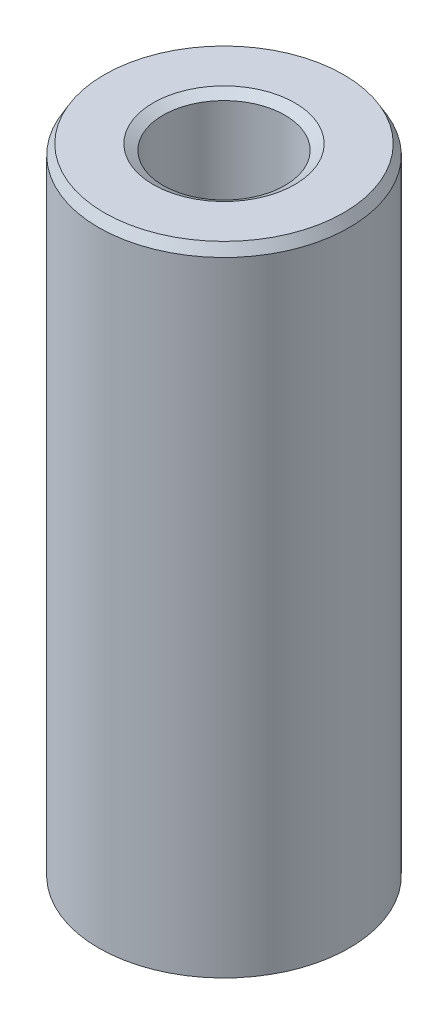
from build123d import *
from OCP.BRepFilletAPI import BRepFilletAPI_MakeChamfer

# Parameters (mm, degrees)
SKETCH1_R           = 17.5
BOSS_EXTRUDE1_DEPTH = 89.271781123
SKETCH2_R           = 8.506520383
CUT_EXTRUDE1_DEPTH  = 93.638819643
CHAMFER1_SIZE       = 1.383278561
CHAMFER1_SIZE2      = 0.798636249


with BuildPart() as part:
    # Sketch1 → Boss-Extrude1 (new body)
    with BuildSketch(Plane(origin=(0, 0, 0), x_dir=(1, 0, 0), z_dir=(0, 1, 0))):
        Circle(SKETCH1_R)
    extrude(amount=BOSS_EXTRUDE1_DEPTH)

    # Sketch2 → Cut-Extrude1 (cut, through all)
    with BuildSketch(Plane(origin=(0, 0, 0), x_dir=(1, 0, 0), z_dir=(0, 1, 0))):
        Circle(SKETCH2_R)
    extrude(amount=CUT_EXTRUDE1_DEPTH, mode=Mode.SUBTRACT)

    # Chamfer1: one chamfer whose edges measure the first distance from different faces: ONE call of the kernel's chamfer builder (chamfer() names one face for all edges)
    chamfer1_edges_1 = [part.edges().sort_by_distance(p)[0] for p in [
        (-8.506520383, 89.271781123, 0),
    ]]
    chamfer1_side_1 = [part.faces().sort_by_distance(p)[0] for p in [
        (-17.005025253, 89.271781123, 0),
    ]]
    chamfer1_edges_2 = [part.edges().sort_by_distance(p)[0] for p in [
        (-8.506520383, 0, 0),
    ]]
    chamfer1_side_2 = [part.faces().sort_by_distance(p)[0] for p in [
        (-8.506520383, 44.635890562, 0),
    ]]
    chamfer1_edges_3 = [part.edges().sort_by_distance(p)[0] for p in [
        (-17.5, 0, 0),
    ]]
    chamfer1_side_3 = [part.faces().sort_by_distance(p)[0] for p in [
        (-17.005025253, 0, 0),
    ]]
    chamfer1_edges_4 = [part.edges().sort_by_distance(p)[0] for p in [
        (-17.5, 89.271781123, 0),
    ]]
    chamfer1_side_4 = [part.faces().sort_by_distance(p)[0] for p in [
        (-17.5, 44.635890562, 0),
    ]]
    chamfer1 = BRepFilletAPI_MakeChamfer(part.part.solid().wrapped)
    for e in chamfer1_edges_1:
        chamfer1.Add(CHAMFER1_SIZE, CHAMFER1_SIZE2, e.wrapped, chamfer1_side_1[0].wrapped)  # the first distance lies on this face
    for e in chamfer1_edges_2:
        chamfer1.Add(CHAMFER1_SIZE, CHAMFER1_SIZE2, e.wrapped, chamfer1_side_2[0].wrapped)  # the first distance lies on this face
    for e in chamfer1_edges_3:
        chamfer1.Add(CHAMFER1_SIZE, CHAMFER1_SIZE2, e.wrapped, chamfer1_side_3[0].wrapped)  # the first distance lies on this face
    for e in chamfer1_edges_4:
        chamfer1.Add(CHAMFER1_SIZE, CHAMFER1_SIZE2, e.wrapped, chamfer1_side_4[0].wrapped)  # the first distance lies on this face
    add(Compound.cast(chamfer1.Shape()), mode=Mode.REPLACE)


solid = part.part
